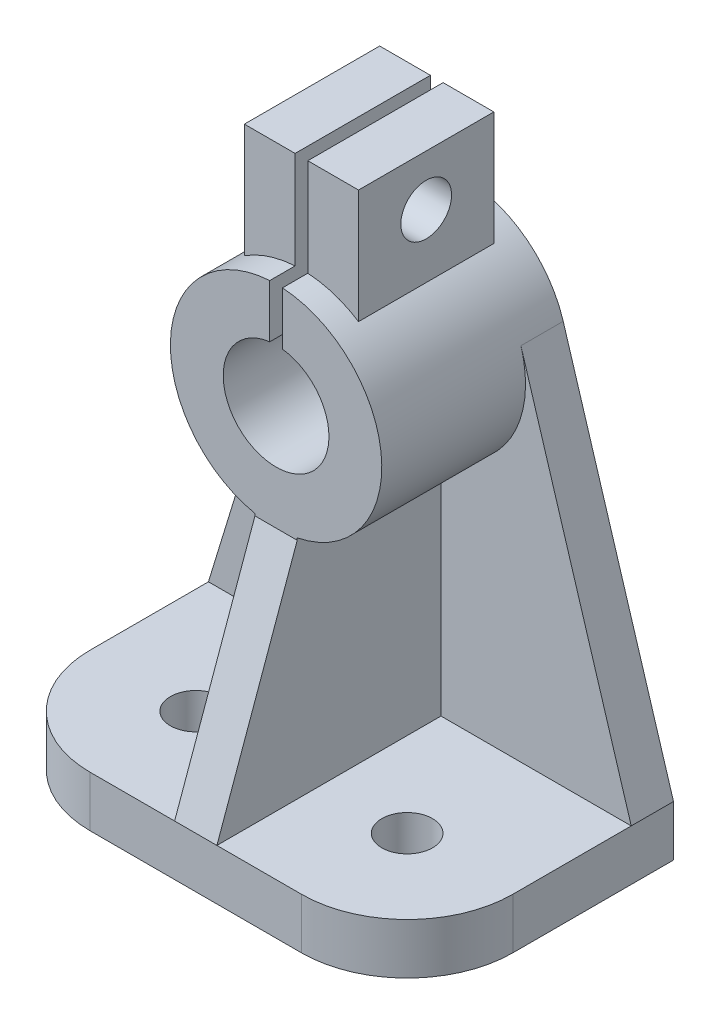
from build123d import *

# Parameters (mm, degrees)
SKETCH2_W                = 100
SKETCH2_H                = 63
BOSS_EXTRUDE1_DEPTH      = 12
FILLET1_R                = 25
SKETCH3_R                = 6
CUT_EXTRUDE1_DEPTH       = 61.301326685
BOSS_EXTRUDE2_DEPTH      = 10
BOSS_EXTRUDE3_DEPTH      = 44
SKETCH7_R                = 12.5
CUT_EXTRUDE2_DEPTH       = 133.894695154
BOSS_EXTRUDE4_REACH      = 152.121
SKETCH8_W                = 27
SKETCH8_H                = 32
SKETCH9_W                = 3
SKETCH9_H                = 50.985533885
CUT_EXTRUDE3_DEPTH       = 154.231850475
SKETCH11_R               = 6
CUT_EXTRUDE4_DEPTH       = 156.140259121
BOSS_EXTRUDE8_DEPTH      = 5
BOSS_EXTRUDE9_REACH      = 95.922
BOSS_EXTRUDE9_END_RADIUS = 25
SKETCH16_W               = 10
SKETCH16_H               = 34


with BuildPart() as part:
    # Sketch2 → Boss-Extrude1 (new body)
    with BuildSketch(Plane(origin=(0, 0, 0), x_dir=(1, 0, 0), z_dir=(0, 1, 0))):
        Rectangle(SKETCH2_W, SKETCH2_H)
    extrude(amount=BOSS_EXTRUDE1_DEPTH)

    # Fillet1
    fillet1_edges = [part.edges().sort_by_distance(p)[0] for p in [
        (50, 6, 31.5),
        (-50, 6, 31.5),
    ]]
    fillet(fillet1_edges, radius=FILLET1_R)

    # Sketch3 → Cut-Extrude1 (cut, through all)
    with BuildSketch(Plane(origin=(0, 12, 0), x_dir=(1, 0, 0), z_dir=(0, 1, 0))):
        with Locations((25, -6.5)):
            Circle(SKETCH3_R)
        with Locations((-25, -6.5)):
            Circle(SKETCH3_R)
    extrude(amount=-CUT_EXTRUDE1_DEPTH, mode=Mode.SUBTRACT)

    # Sketch6 → Boss-Extrude2 (add)
    with BuildSketch(Plane(origin=(0, 0, -31.5), x_dir=(-1, 0, 0), z_dir=(0, 0, -1))):
        with BuildLine():
            Line((-50, 12), (50, 12))
            Line((50, 12), (23.906779363, 97.312038053))
            ThreePointArc((23.906779363, 97.312038053), (0, 115), (-23.906779363, 97.312038053))
            Line((-23.906779363, 97.312038053), (-50, 12))
        make_face()
    extrude(amount=-BOSS_EXTRUDE2_DEPTH)

    # Sketch6<3> → Boss-Extrude3 (add)
    with BuildSketch(Plane(origin=(0, 0, -31.5), x_dir=(-1, 0, 0), z_dir=(0, 0, -1))):
        with BuildLine():
            ThreePointArc((-23.906779363, 97.312038053), (-3.696654969, 65.274815632), (25, 90))
            ThreePointArc((25, 90), (24.725184368, 93.696654969), (23.906779363, 97.312038053))
            ThreePointArc((23.906779363, 97.312038053), (0, 115), (-23.906779363, 97.312038053))
        make_face()
    extrude(amount=-BOSS_EXTRUDE3_DEPTH)

    # Sketch7 → Cut-Extrude2 (cut, through all)
    with BuildSketch(Plane.XY.offset(12.5)):
        with Locations((0, 90)):
            Circle(SKETCH7_R)
    extrude(amount=-CUT_EXTRUDE2_DEPTH, mode=Mode.SUBTRACT)

    # Sketch8 → Boss-Extrude4 (add, up to next)
    with BuildSketch(Plane(origin=(0, 138, 0), x_dir=(1, 0, 0), z_dir=(0, 1, 0)), mode=Mode.PRIVATE) as boss_extrude4_sk1:
        with Locations((0, 9.5)):
            Rectangle(SKETCH8_W, SKETCH8_H)
    boss_extrude4_tool1 = extrude(boss_extrude4_sk1.sketch, amount=-BOSS_EXTRUDE4_REACH, mode=Mode.PRIVATE) - part.part
    add(boss_extrude4_tool1.solids().sort_by_distance((0, 138, -9.5))[0])

    # Sketch9 → Cut-Extrude3 (cut, through all)
    with BuildSketch(Plane.XY.offset(12.5)):
        with Locations((0, 121.060567284)):
            Rectangle(SKETCH9_W, SKETCH9_H)
    extrude(amount=-CUT_EXTRUDE3_DEPTH, mode=Mode.SUBTRACT)

    # Sketch11 → Cut-Extrude4 (cut, through all)
    with BuildSketch(Plane.ZY.offset(13.5)):
        with Locations((-9.5, 126)):
            Circle(SKETCH11_R)
    extrude(amount=-CUT_EXTRUDE4_DEPTH, mode=Mode.SUBTRACT)



with BuildPart() as body_2:
    # Sketch14 → Boss-Extrude8 (new, symmetric)
    with BuildSketch(Plane(origin=(0, 0, 0), x_dir=(0, 0, -1), z_dir=(1, 0, 0))):
        Polygon((-12.5, 65), (-31.5, 12), (21.5, 12), (21.5, 65), align=None)
    extrude(amount=BOSS_EXTRUDE8_DEPTH, both=True)


with BuildPart() as part_1:
    add(part.part)

    add(body_2.part)  # Boss-Extrude9 merges body 2
    # Boss-Extrude9: up to this cylinder (the profile starts outside it)
    boss_extrude9_end = Plane(origin=(0, 90, -4.5), z_dir=(0, 0, -1)) * Cylinder(BOSS_EXTRUDE9_END_RADIUS, 242.844, mode=Mode.PRIVATE)
    # Sketch16 → Boss-Extrude9 (add, up to the surface)
    with BuildSketch(Plane(origin=(0, 65, 0), x_dir=(1, 0, 0), z_dir=(0, 1, 0)), mode=Mode.PRIVATE) as boss_extrude9_sk1:
        with Locations((0, 4.5)):
            Rectangle(SKETCH16_W, SKETCH16_H)
    boss_extrude9_tool1 = extrude(boss_extrude9_sk1.sketch, amount=BOSS_EXTRUDE9_REACH, mode=Mode.PRIVATE) - boss_extrude9_end
    add(boss_extrude9_tool1.solids().sort_by_distance((0, 65, -4.5))[0])
    add(boss_extrude9_tool1.solids().sort_by_distance((0, 65, -4.5))[1])


solid = part_1.part
